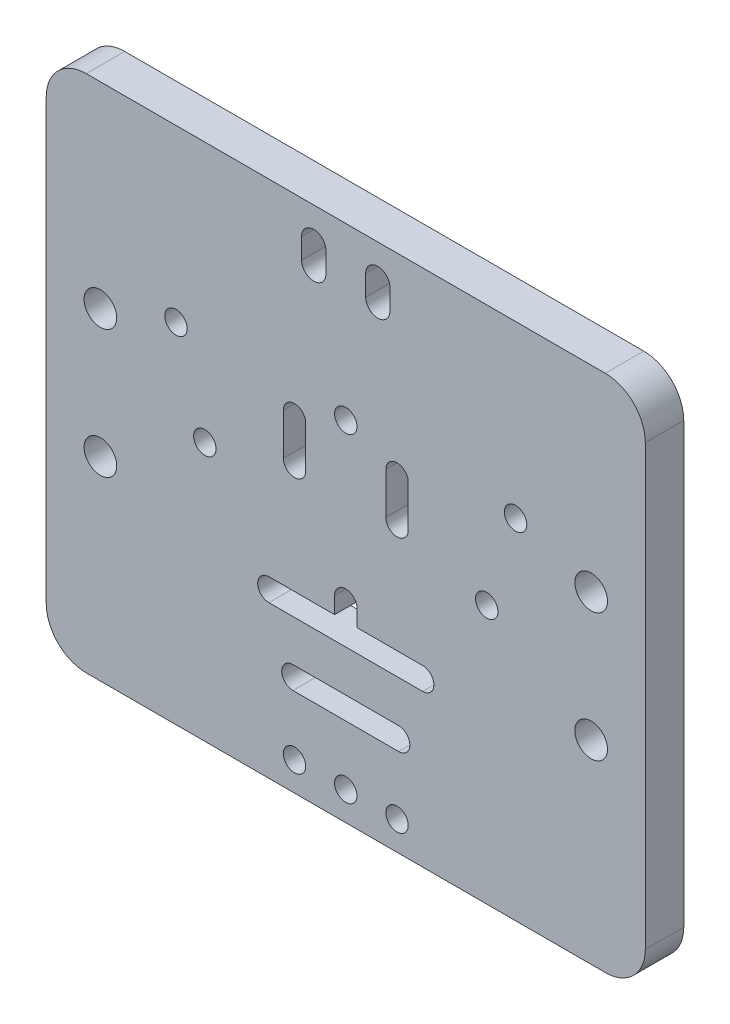
from build123d import *

# Parameters (mm, degrees)
MODEL_R    = 1.75
MODEL_R_2  = 2.55
BASE_DEPTH = 6


with BuildPart() as part:
    # Model → Base (new body)
    with BuildSketch(Plane.XY):
        with BuildLine():
            Line((46.75, 6.25), (46.75, 74.75))
            ThreePointArc((46.75, 74.75), (44.919417382, 79.169417382), (40.5, 81))
            Line((40.5, 81), (-40.5, 81))
            ThreePointArc((-40.5, 81), (-44.919417382, 79.169417382), (-46.75, 74.75))
            Line((-46.75, 74.75), (-46.75, 6.25))
            ThreePointArc((-46.75, 6.25), (-44.919417382, 1.830582618), (-40.5, 0))
            Line((-40.5, 0), (40.5, 0))
            ThreePointArc((40.5, 0), (44.919417382, 1.830582618), (46.75, 6.25))
        make_face()
        with Locations((-8, 4.5)):
            Circle(MODEL_R, mode=Mode.SUBTRACT)
        with Locations((0, 4.5)):
            Circle(MODEL_R, mode=Mode.SUBTRACT)
        with BuildLine():
            Line((-8.25, 17.25), (8.25, 17.25))
            ThreePointArc((8.25, 17.25), (10, 15.5), (8.25, 13.75))
            Line((8.25, 13.75), (-8.25, 13.75))
            ThreePointArc((-8.25, 13.75), (-10, 15.5), (-8.25, 17.25))
        make_face(mode=Mode.SUBTRACT)
        with Locations((-38.3, 30.35)):
            Circle(MODEL_R_2, mode=Mode.SUBTRACT)
        with BuildLine():
            Line((-1.75, 27.25), (-1.75, 29.85))
            ThreePointArc((-1.75, 29.85), (0, 31.6), (1.75, 29.85))
            Line((1.75, 29.85), (1.75, 27.25))
            Line((1.75, 27.25), (12, 27.25))
            ThreePointArc((12, 27.25), (13.75, 25.5), (12, 23.75))
            Line((12, 23.75), (-12, 23.75))
            ThreePointArc((-12, 23.75), (-13.75, 25.5), (-12, 27.25))
            Line((-12, 27.25), (-1.75, 27.25))
        make_face(mode=Mode.SUBTRACT)
        with Locations((-22, 40.4)):
            Circle(MODEL_R, mode=Mode.SUBTRACT)
        with Locations((8, 4.5)):
            Circle(MODEL_R, mode=Mode.SUBTRACT)
        with Locations((22, 40.4)):
            Circle(MODEL_R, mode=Mode.SUBTRACT)
        with Locations((38.3, 30.35)):
            Circle(MODEL_R_2, mode=Mode.SUBTRACT)
        with Locations((-38.3, 50.35)):
            Circle(MODEL_R_2, mode=Mode.SUBTRACT)
        with Locations((-26.5, 54.4)):
            Circle(MODEL_R, mode=Mode.SUBTRACT)
        with BuildLine():
            Line((-9.75, 44.4), (-9.75, 50.9))
            ThreePointArc((-9.75, 50.9), (-8, 52.65), (-6.25, 50.9))
            Line((-6.25, 50.9), (-6.25, 44.4))
            ThreePointArc((-6.25, 44.4), (-8, 42.65), (-9.75, 44.4))
        make_face(mode=Mode.SUBTRACT)
        with Locations((0, 54.4)):
            Circle(MODEL_R, mode=Mode.SUBTRACT)
        with BuildLine():
            ThreePointArc((-6.9, 75.8), (-5, 77.7), (-3.1, 75.8))
            Line((-3.1, 75.8), (-3.1, 72.6))
            ThreePointArc((-3.1, 72.6), (-5, 70.7), (-6.9, 72.6))
            Line((-6.9, 72.6), (-6.9, 75.8))
        make_face(mode=Mode.SUBTRACT)
        with BuildLine():
            Line((9.75, 50.9), (9.75, 44.4))
            ThreePointArc((9.75, 44.4), (8, 42.65), (6.25, 44.4))
            Line((6.25, 44.4), (6.25, 50.9))
            ThreePointArc((6.25, 50.9), (8, 52.65), (9.75, 50.9))
        make_face(mode=Mode.SUBTRACT)
        with Locations((38.3, 50.35)):
            Circle(MODEL_R_2, mode=Mode.SUBTRACT)
        with Locations((26.5, 54.4)):
            Circle(MODEL_R, mode=Mode.SUBTRACT)
        with BuildLine():
            ThreePointArc((6.9, 72.6), (5, 70.7), (3.1, 72.6))
            Line((3.1, 72.6), (3.1, 75.8))
            ThreePointArc((3.1, 75.8), (5, 77.7), (6.9, 75.8))
            Line((6.9, 75.8), (6.9, 72.6))
        make_face(mode=Mode.SUBTRACT)
    extrude(amount=BASE_DEPTH)


solid = part.part
